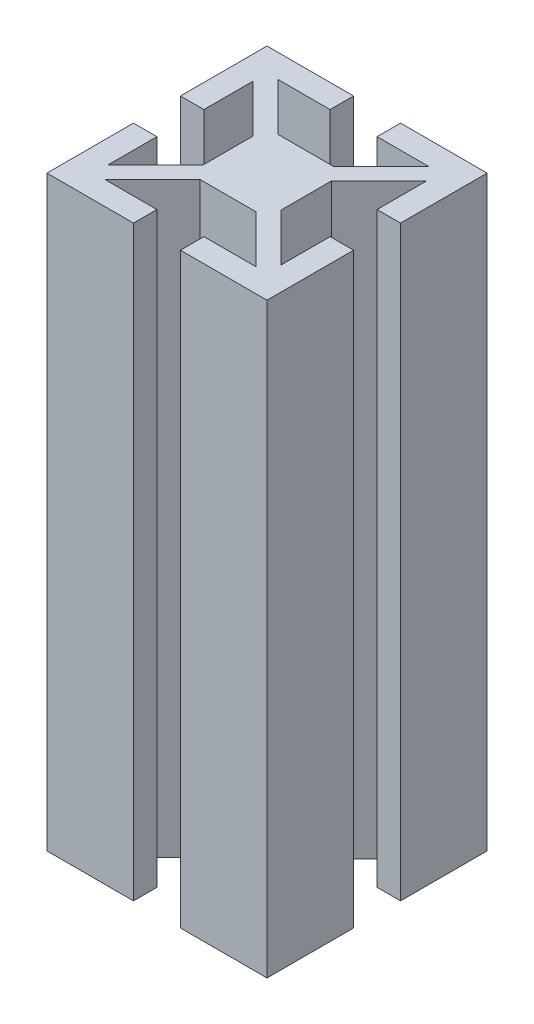
from build123d import *

# Parameters (mm, degrees)
EXTRUDE1_DEPTH = 101.6


# Read off the part's stored shape, not the designer's step: 1515<1>
with BuildPart() as part:
    # Sketch1<2> → Extrude1 (new body)
    with BuildSketch(Plane(origin=(0, 0, 0), x_dir=(1, 0, 0), z_dir=(0, 1, 0))):
        Polygon((-6.7564, 4.364749804), (-6.7564, -4.364749804), (-14.986, -12.594349804), (-14.986, -4.064), (-19.05, -4.064), (-19.05, -19.05), (-4.064, -19.05), (-4.064, -14.986), (-13.067127258, -14.986), (-4.837527258, -6.7564), (4.837527258, -6.7564), (13.067127258, -14.986), (4.064, -14.986), (4.064, -19.05), (19.05, -19.05), (19.05, -4.064), (14.986, -4.064), (14.986, -12.594349804), (6.7564, -4.364749804), (6.7564, 4.364749804), (14.986, 12.594349804), (14.986, 4.064), (19.05, 4.064), (19.05, 19.05), (4.064, 19.05), (4.064, 14.986), (13.067127258, 14.986), (4.837527258, 6.7564), (-4.837527258, 6.7564), (-13.067127258, 14.986), (-4.064, 14.986), (-4.064, 19.05), (-19.05, 19.05), (-19.05, 4.064), (-14.986, 4.064), (-14.986, 12.594349804), align=None)
    extrude(amount=EXTRUDE1_DEPTH)


solid = part.part
